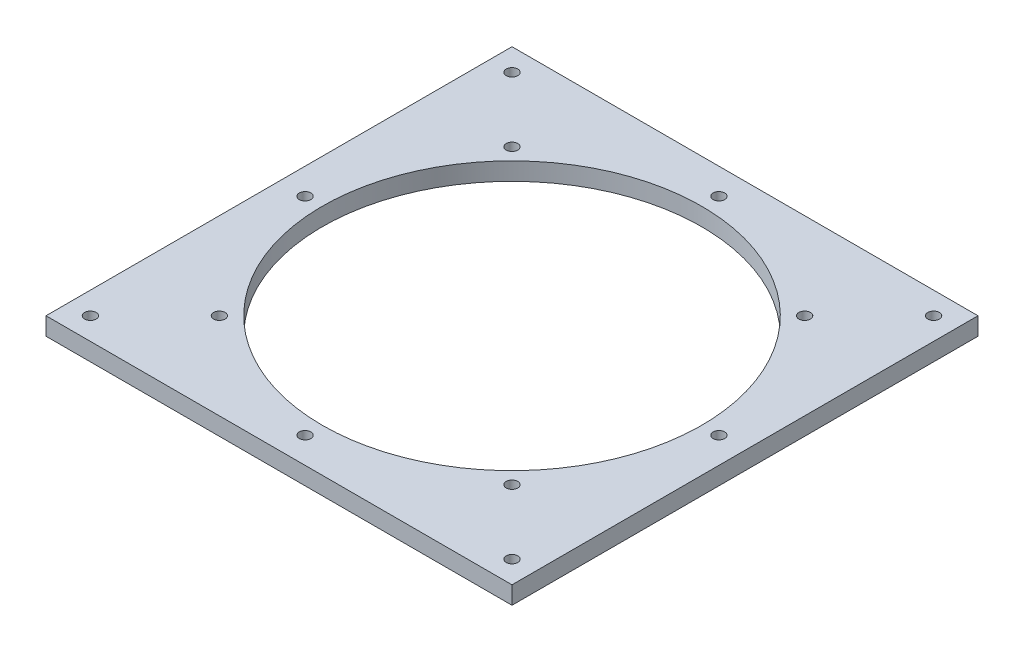
from build123d import *

# Parameters (mm, degrees)
SKETCH_1_W          = 210
SKETCH_1_H          = 210
SKETCH_1_R          = 2.6
SKETCH_1_R_2        = 85.5
EXTRUDE_1_DEPTH     = 8
SKETCH_2_R          = 2.6
CUT_EXTRUDE_1_DEPTH = 10


with BuildPart() as part:
    # 草图1 → 凸台-拉伸1 (new body)
    with BuildSketch(Plane(origin=(0, 0, 0), x_dir=(1, 0, 0), z_dir=(0, 1, 0))):
        Rectangle(SKETCH_1_W, SKETCH_1_H)
        with Locations((0, -93.25)):
            Circle(SKETCH_1_R, mode=Mode.SUBTRACT)
        with Locations((93.25, 0)):
            Circle(SKETCH_1_R, mode=Mode.SUBTRACT)
        with Locations((-93.25, 0)):
            Circle(SKETCH_1_R, mode=Mode.SUBTRACT)
        Circle(SKETCH_1_R_2, mode=Mode.SUBTRACT)
        with BuildLine():
            ThreePointArc((0, 90.65), (-2.6, 93.25), (0, 95.85))
            ThreePointArc((0, 95.85), (2.6, 93.25), (0, 90.65))
        make_face(mode=Mode.SUBTRACT)
    extrude(amount=EXTRUDE_1_DEPTH)

    # 草图2 → 切除-拉伸1 (cut)
    with BuildSketch(Plane(origin=(0, 8, 0), x_dir=(1, 0, 0), z_dir=(0, 1, 0))):
        with Locations((-95, 95)):
            Circle(SKETCH_2_R)
        with Locations((95, 95)):
            Circle(SKETCH_2_R)
        with Locations((95, -95)):
            Circle(SKETCH_2_R)
        with Locations((-95, -95)):
            Circle(SKETCH_2_R)
        with Locations((65.937707346, 65.937707346)):
            Circle(SKETCH_2_R)
        with Locations((65.937707346, -65.937707346)):
            Circle(SKETCH_2_R)
        with Locations((-65.937707346, -65.937707346)):
            Circle(SKETCH_2_R)
        with Locations((-65.937707346, 65.937707346)):
            Circle(SKETCH_2_R)
    extrude(amount=-CUT_EXTRUDE_1_DEPTH, mode=Mode.SUBTRACT)


solid = part.part
